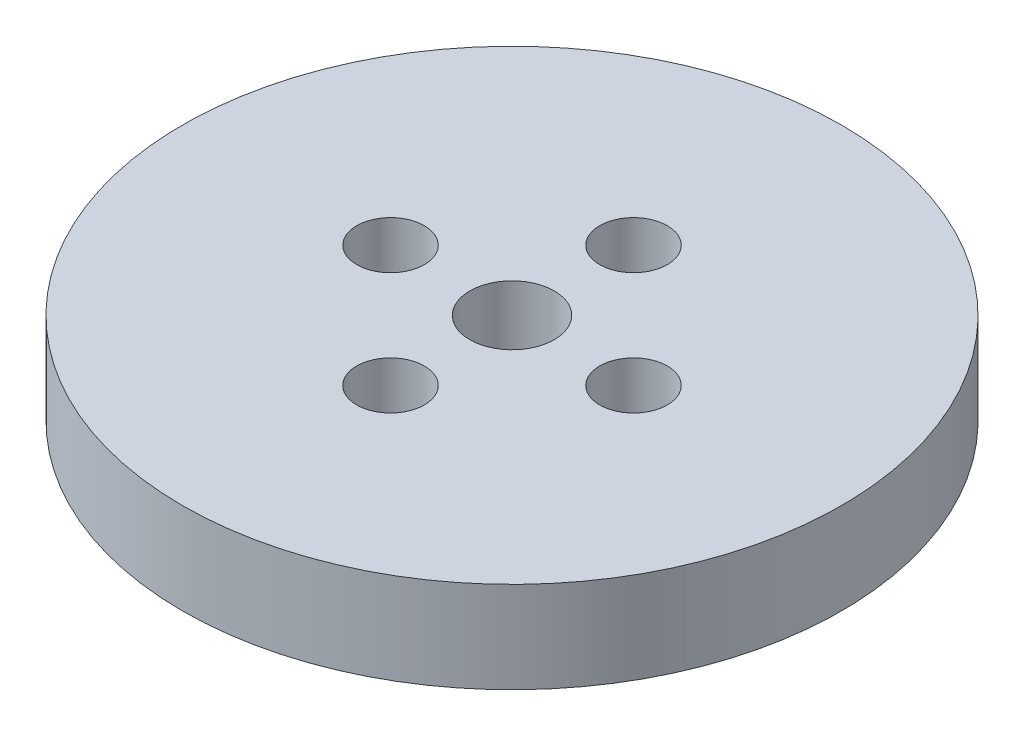
from build123d import *

# Parameters (mm, degrees)
SKETCH1_R           = 97.5
BOSS_EXTRUDE1_DEPTH = 27
SKETCH2_R           = 12.5
CUT_EXTRUDE1_DEPTH  = 141.504448328
SKETCH3_R           = 10
CUT_EXTRUDE2_DEPTH  = 18.780981537
CIRPATTERN1_COUNT   = 4


with BuildPart() as part:
    # Sketch1 → Boss-Extrude1 (new body)
    with BuildSketch(Plane(origin=(0, 0, 0), x_dir=(1, 0, 0), z_dir=(0, 1, 0))):
        Circle(SKETCH1_R)
    extrude(amount=BOSS_EXTRUDE1_DEPTH)

    # Sketch2 → Cut-Extrude1 (cut, through all)
    with BuildSketch(Plane(origin=(0, 0, 0), x_dir=(1, 0, 0), z_dir=(0, 1, 0))):
        Circle(SKETCH2_R)
    extrude(amount=CUT_EXTRUDE1_DEPTH, mode=Mode.SUBTRACT)

    # Sketch3 → Cut-Extrude2 (cut)
    with BuildSketch(Plane(origin=(0, 27, 0), x_dir=(1, 0, 0), z_dir=(0, 1, 0))):
        with Locations((-35.944708924, 0)):
            Circle(SKETCH3_R)
    cut_extrude2 = extrude(amount=-CUT_EXTRUDE2_DEPTH, mode=Mode.SUBTRACT)

    # CirPattern1: Cut-Extrude2 ×4 about axis
    cirpattern1_axis = Axis((0, 0, 0), (0, 1, 0))
    for i in range(1, CIRPATTERN1_COUNT):
        add(cut_extrude2.rotate(cirpattern1_axis, i * 360 / CIRPATTERN1_COUNT), mode=Mode.SUBTRACT)


solid = part.part
